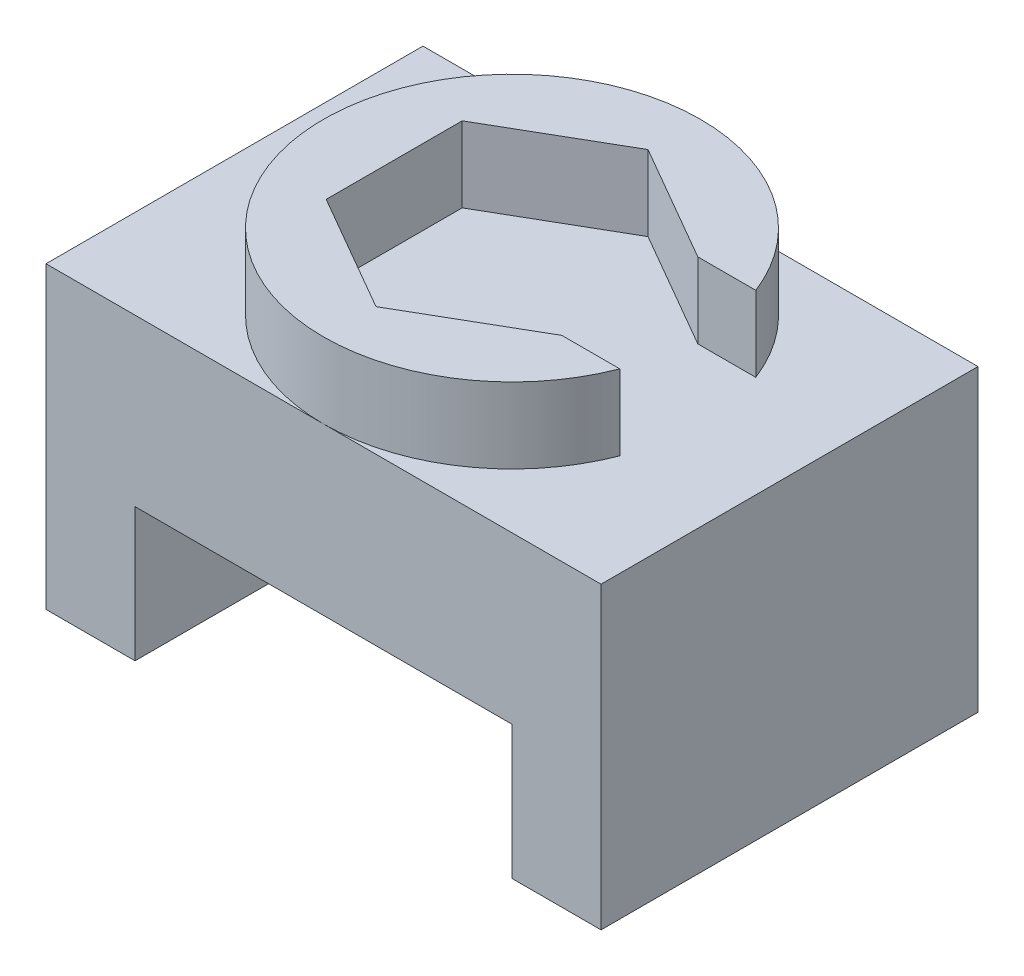
from build123d import *

# Parameters (mm, degrees)
BOSS_EXTRUDE1_DEPTH = 25.4
BOSS_EXTRUDE3_DEPTH = 5.08


with BuildPart() as part:
    # Sketch1 → Boss-Extrude1 (new body)
    with BuildSketch(Plane.XY):
        Polygon((-10.189534884, 0), (-10.189534884, 9), (15.210465116, 9), (15.210465116, 0), (21.210465116, 0), (21.210465116, 20.17346), (-16.189534884, 20.17346), (-16.189534884, 0), align=None)
    extrude(amount=BOSS_EXTRUDE1_DEPTH)

    # Sketch3 → Boss-Extrude3 (add)
    with BuildSketch(Plane(origin=(0, 20.17346, 0), x_dir=(1, 0, 0), z_dir=(0, 1, 0))):
        with BuildLine():
            ThreePointArc((14.354818113, -8.117282238), (9.689931824, -2.224062916), (2.510465116, 0))
            ThreePointArc((2.510465116, 0), (-10.189534884, -12.7), (2.510465116, -25.4))
            ThreePointArc((2.510465116, -25.4), (9.689931824, -23.175937084), (14.354818113, -17.282717762))
            Line((14.354818113, -17.282717762), (10.447965116, -17.282717762))
            Line((10.447965116, -17.282717762), (2.510465116, -21.865435523))
            Line((2.510465116, -21.865435523), (-5.427034884, -17.282717762))
            Line((-5.427034884, -17.282717762), (-5.427034884, -8.117282238))
            Line((-5.427034884, -8.117282238), (2.510465116, -3.534564477))
            Line((2.510465116, -3.534564477), (10.447965116, -8.117282238))
            Line((10.447965116, -8.117282238), (14.354818113, -8.117282238))
        make_face()
    extrude(amount=BOSS_EXTRUDE3_DEPTH)


solid = part.part
